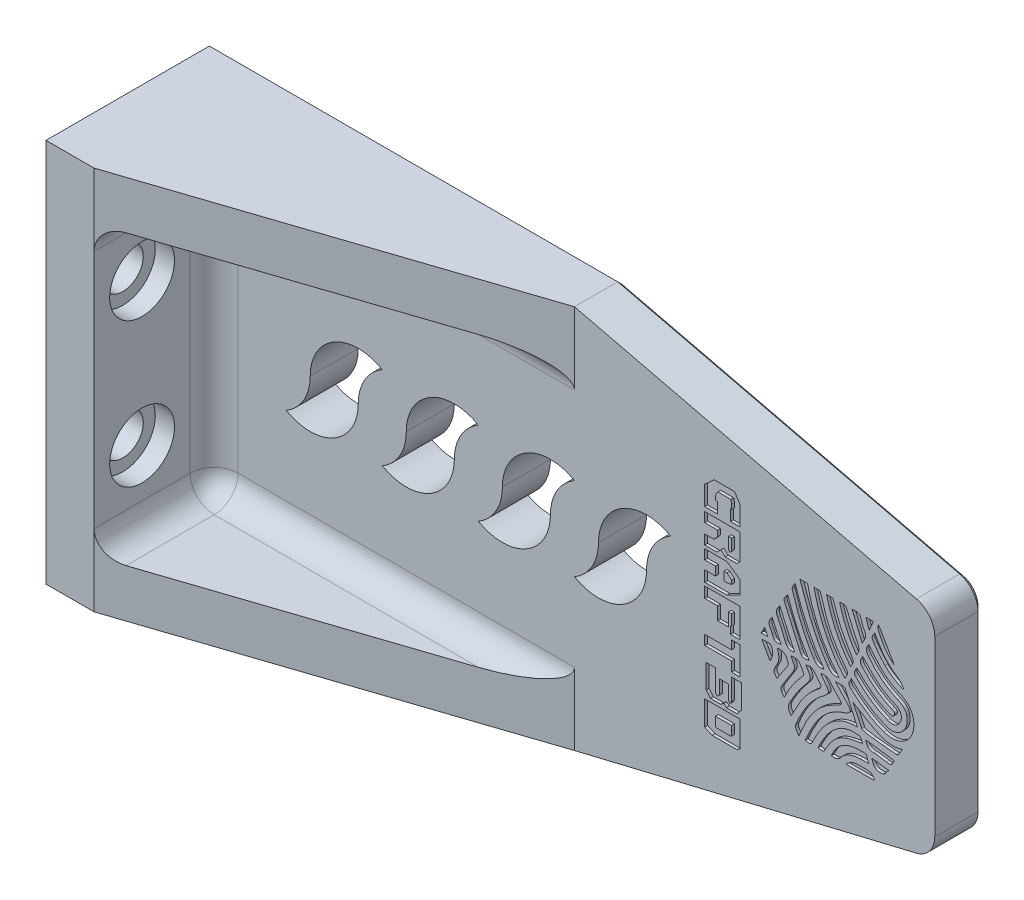
from build123d import *

# Parameters (mm, degrees)
SKETCH1_W           = 160
SKETCH1_H           = 80
BOSS_EXTRUDE1_DEPTH = 10
SKETCH2_R           = 1.325
SKETCH2_R_2         = 12.5
CUT_EXTRUDE1_DEPTH  = 3
CUT_EXTRUDE2_REACH  = 91.716
SKETCH4_R           = 1.325
SKETCH4_R_2         = 6.375
SKETCH7_W           = 10
SKETCH7_H           = 80
BOSS_EXTRUDE3_DEPTH = 25
BOSS_EXTRUDE4_DEPTH = 10
BOSS_EXTRUDE5_DEPTH = 10
CUT_EXTRUDE3_REACH  = 94.871
CUT_EXTRUDE4_DEPTH  = 10
FILLET1_R           = 5
SKETCH12_R          = 3.25
CUT_EXTRUDE5_DEPTH  = 4.5
CUT_EXTRUDE6_REACH  = 161.138
SKETCH13_R          = 4.25
SKETCH14_R          = 6.75
CUT_EXTRUDE7_DEPTH  = 4
FILLET2_R           = 5
CHAMFER2_SIZE       = 1
BOSS_EXTRUDE6_START = 3
SKETCH15_R          = 12.5
SKETCH15_R_2        = 1.325
BOSS_EXTRUDE6_DEPTH = 3
SKETCH16_R          = 3.25
BOSS_EXTRUDE7_DEPTH = 4.5
CUT_EXTRUDE9_DEPTH  = 0.6
SKETCH21_R          = 15
CUT_EXTRUDE10_DEPTH = 7
SKETCH22_R          = 3.925
BOSS_EXTRUDE8_DEPTH = 7
CHAMFER3_SIZE       = 1
CUT_EXTRUDE11_REACH = 98.047
SKETCH23_W          = 10
SKETCH23_H          = 2
CHAMFER4_SIZE       = 1


with BuildPart() as part:
    # Sketch1 → Boss-Extrude1 (new body)
    with BuildSketch(Plane.XY):
        Rectangle(SKETCH1_W, SKETCH1_H)
    extrude(amount=BOSS_EXTRUDE1_DEPTH)

    # Sketch2 → Cut-Extrude1 (cut)
    with BuildSketch(Plane.XY.offset(10)):
        with Locations((44, 15.5)):
            Circle(SKETCH2_R)
        with Locations((75, 15.5)):
            Circle(SKETCH2_R)
        with Locations((44, -15.5)):
            Circle(SKETCH2_R)
        with Locations((75, -15.5)):
            Circle(SKETCH2_R)
        with Locations((59.5, 0)):
            Circle(SKETCH2_R_2)
    extrude(amount=-CUT_EXTRUDE1_DEPTH, mode=Mode.SUBTRACT)

    # Sketch4 → Cut-Extrude2 (cut, up to next)
    with BuildSketch(Plane.XY.offset(7), mode=Mode.PRIVATE) as cut_extrude2_sk1:
        with Locations((75, -15.5)):
            Circle(SKETCH4_R)
    cut_extrude2_tool1 = extrude(cut_extrude2_sk1.sketch, amount=-CUT_EXTRUDE2_REACH, mode=Mode.PRIVATE) & part.part
    # Sketch4 → Cut-Extrude2 (cut, up to next)
    with BuildSketch(Plane.XY.offset(7), mode=Mode.PRIVATE) as cut_extrude2_sk2:
        with Locations((44, -15.5)):
            Circle(SKETCH4_R)
    cut_extrude2_tool2 = extrude(cut_extrude2_sk2.sketch, amount=-CUT_EXTRUDE2_REACH, mode=Mode.PRIVATE) & part.part
    # Sketch4 → Cut-Extrude2 (cut, up to next)
    with BuildSketch(Plane.XY.offset(7), mode=Mode.PRIVATE) as cut_extrude2_sk3:
        with Locations((75, 15.5)):
            Circle(SKETCH4_R)
    cut_extrude2_tool3 = extrude(cut_extrude2_sk3.sketch, amount=-CUT_EXTRUDE2_REACH, mode=Mode.PRIVATE) & part.part
    # Sketch4 → Cut-Extrude2 (cut, up to next)
    with BuildSketch(Plane.XY.offset(7), mode=Mode.PRIVATE) as cut_extrude2_sk4:
        with Locations((44, 15.5)):
            Circle(SKETCH4_R)
    cut_extrude2_tool4 = extrude(cut_extrude2_sk4.sketch, amount=-CUT_EXTRUDE2_REACH, mode=Mode.PRIVATE) & part.part
    # Sketch4 → Cut-Extrude2 (cut, up to next)
    with BuildSketch(Plane.XY.offset(7), mode=Mode.PRIVATE) as cut_extrude2_sk5:
        with Locations((59.5, 0)):
            Circle(SKETCH4_R_2)
    cut_extrude2_tool5 = extrude(cut_extrude2_sk5.sketch, amount=-CUT_EXTRUDE2_REACH, mode=Mode.PRIVATE) & part.part
    add(cut_extrude2_tool1.solids().sort_by_distance((75, -15.5, 7))[0], mode=Mode.SUBTRACT)
    add(cut_extrude2_tool2.solids().sort_by_distance((44, -15.5, 7))[0], mode=Mode.SUBTRACT)
    add(cut_extrude2_tool3.solids().sort_by_distance((75, 15.5, 7))[0], mode=Mode.SUBTRACT)
    add(cut_extrude2_tool4.solids().sort_by_distance((44, 15.5, 7))[0], mode=Mode.SUBTRACT)
    add(cut_extrude2_tool5.solids().sort_by_distance((59.5, 0, 7))[0], mode=Mode.SUBTRACT)

    # Sketch7 → Boss-Extrude3 (add)
    with BuildSketch(Plane.XY.offset(10)):
        with Locations((-75, 0)):
            Rectangle(SKETCH7_W, SKETCH7_H)
    extrude(amount=BOSS_EXTRUDE3_DEPTH)

    # Sketch8 → Boss-Extrude4 (add)
    with BuildSketch(Plane(origin=(0, 40, 0), x_dir=(1, 0, 0), z_dir=(0, 1, 0))):
        Polygon((-70, -35), (5, -10), (-70, -10), align=None)
    extrude(amount=-BOSS_EXTRUDE4_DEPTH)

    # Sketch9 → Boss-Extrude5 (add)
    with BuildSketch(Plane.XZ.offset(40)):
        Polygon((-70, 35), (-70, 10), (5, 10), align=None)
    extrude(amount=-BOSS_EXTRUDE5_DEPTH)

    # Sketch10 → Cut-Extrude3 (cut, up to next)
    with BuildSketch(Plane.XY.offset(10), mode=Mode.PRIVATE) as cut_extrude3_sk1:
        with BuildLine():
            ThreePointArc((5, -8.660254038), (15, -8.660254038), (20, 0))
            ThreePointArc((20, 0), (21.339745962, 5), (25, 8.660254038))
            ThreePointArc((25, 8.660254038), (15, 8.660254038), (10, 0))
            ThreePointArc((10, 0), (8.660254038, -5), (5, -8.660254038))
        make_face()
    cut_extrude3_tool1 = extrude(cut_extrude3_sk1.sketch, amount=-CUT_EXTRUDE3_REACH, mode=Mode.PRIVATE) & part.part
    # Sketch10 → Cut-Extrude3 (cut, up to next)
    with BuildSketch(Plane.XY.offset(10), mode=Mode.PRIVATE) as cut_extrude3_sk2:
        with BuildLine():
            ThreePointArc((0, 0), (1.339745962, 5), (5, 8.660254038))
            ThreePointArc((5, 8.660254038), (-5, 8.660254038), (-10, 0))
            ThreePointArc((-10, 0), (-11.339745962, -5), (-15, -8.660254038))
            ThreePointArc((-15, -8.660254038), (-5, -8.660254038), (0, 0))
        make_face()
    cut_extrude3_tool2 = extrude(cut_extrude3_sk2.sketch, amount=-CUT_EXTRUDE3_REACH, mode=Mode.PRIVATE) & part.part
    # Sketch10 → Cut-Extrude3 (cut, up to next)
    with BuildSketch(Plane.XY.offset(10), mode=Mode.PRIVATE) as cut_extrude3_sk3:
        with BuildLine():
            ThreePointArc((-20, 0), (-18.660254038, 5), (-15, 8.660254038))
            ThreePointArc((-15, 8.660254038), (-25, 8.660254038), (-30, 0))
            ThreePointArc((-30, 0), (-31.339745962, -5), (-35, -8.660254038))
            ThreePointArc((-35, -8.660254038), (-25, -8.660254038), (-20, 0))
        make_face()
    cut_extrude3_tool3 = extrude(cut_extrude3_sk3.sketch, amount=-CUT_EXTRUDE3_REACH, mode=Mode.PRIVATE) & part.part
    # Sketch10 → Cut-Extrude3 (cut, up to next)
    with BuildSketch(Plane.XY.offset(10), mode=Mode.PRIVATE) as cut_extrude3_sk4:
        with BuildLine():
            ThreePointArc((-40, 0), (-38.660254038, 5), (-35, 8.660254038))
            ThreePointArc((-35, 8.660254038), (-45, 8.660254038), (-50, 0))
            ThreePointArc((-50, 0), (-51.339745962, -5), (-55, -8.660254038))
            ThreePointArc((-55, -8.660254038), (-45, -8.660254038), (-40, 0))
        make_face()
    cut_extrude3_tool4 = extrude(cut_extrude3_sk4.sketch, amount=-CUT_EXTRUDE3_REACH, mode=Mode.PRIVATE) & part.part
    add(cut_extrude3_tool1.solids().sort_by_distance((15, 0, 10))[0], mode=Mode.SUBTRACT)
    add(cut_extrude3_tool2.solids().sort_by_distance((-5, 0, 10))[0], mode=Mode.SUBTRACT)
    add(cut_extrude3_tool3.solids().sort_by_distance((-25, 0, 10))[0], mode=Mode.SUBTRACT)
    add(cut_extrude3_tool4.solids().sort_by_distance((-45, 0, 10))[0], mode=Mode.SUBTRACT)

    # Sketch11 → Cut-Extrude4 (cut)
    with BuildSketch(Plane.XY.offset(10)):
        Polygon((80, 22), (5, 40), (80, 40), align=None)
        Polygon((80, -40), (80, -22), (5, -40), align=None)
    extrude(amount=-CUT_EXTRUDE4_DEPTH, mode=Mode.SUBTRACT)

    # Fillet1
    fillet1_edges = [part.edges().sort_by_distance(p)[0] for p in [
        (-70, 30, 22.5),
        (-32.5, 30, 10),
        (-70, 0, 10),
        (-32.5, -30, 10),
        (-70, -30, 22.5),
    ]]
    fillet(fillet1_edges, radius=FILLET1_R)

    # Sketch12 → Cut-Extrude5 (cut)
    with BuildSketch(Plane(origin=(0, 0, 0), x_dir=(-1, 0, 0), z_dir=(0, 0, -1))):
        with Locations((-75, 15.5)):
            Circle(SKETCH12_R)
        with Locations((-44, 15.5)):
            Circle(SKETCH12_R)
        with Locations((-44, -15.5)):
            Circle(SKETCH12_R)
        with Locations((-75, -15.5)):
            Circle(SKETCH12_R)
    extrude(amount=-CUT_EXTRUDE5_DEPTH, mode=Mode.SUBTRACT)

    # Sketch13 → Cut-Extrude6 (cut, up to next)
    with BuildSketch(Plane(origin=(-70, 0, 0), x_dir=(0, 0, -1), z_dir=(1, 0, 0)), mode=Mode.PRIVATE) as cut_extrude6_sk1:
        with Locations(Location((-25, 15, 0), (0, 0, 90))):
            Circle(SKETCH13_R)
    cut_extrude6_tool1 = extrude(cut_extrude6_sk1.sketch, amount=-CUT_EXTRUDE6_REACH, mode=Mode.PRIVATE) & part.part
    # Sketch13 → Cut-Extrude6 (cut, up to next)
    with BuildSketch(Plane(origin=(-70, 0, 0), x_dir=(0, 0, -1), z_dir=(1, 0, 0)), mode=Mode.PRIVATE) as cut_extrude6_sk2:
        with Locations((-25, -15)):
            Circle(SKETCH13_R)
    cut_extrude6_tool2 = extrude(cut_extrude6_sk2.sketch, amount=-CUT_EXTRUDE6_REACH, mode=Mode.PRIVATE) & part.part
    add(cut_extrude6_tool1.solids().sort_by_distance((-70, 15, 25))[0], mode=Mode.SUBTRACT)
    add(cut_extrude6_tool2.solids().sort_by_distance((-70, -15, 25))[0], mode=Mode.SUBTRACT)

    # Sketch14 → Cut-Extrude7 (cut)
    with BuildSketch(Plane(origin=(-70, 0, 0), x_dir=(0, 0, -1), z_dir=(1, 0, 0))):
        with Locations(Location((-25, 15, 0), (0, 0, 90))):
            Circle(SKETCH14_R)
        with Locations(Location((-25, -15, 0), (0, 0, 90))):
            Circle(SKETCH14_R)
    extrude(amount=-CUT_EXTRUDE7_DEPTH, mode=Mode.SUBTRACT)

    # Fillet2
    fillet2_edges = [part.edges().sort_by_distance(p)[0] for p in [
        (80, 22, 5),
        (80, -22, 5),
    ]]
    fillet(fillet2_edges, radius=FILLET2_R)

    # Chamfer2
    chamfer2_edges = [part.edges().sort_by_distance(p)[0] for p in [
        (-37.5, 40, 0),
        (40.583432381, 31.459976229, 0),
        (40.583432381, -31.459976229, 0),
        (80, 0, 0),
        (78.926469394, 21.153631895, 0),
        (78.926469394, -21.153631895, 0),
        (53.125, 0, 0),
        (-37.5, -40, 0),
        (-80, 0, 0),
    ]]
    chamfer(chamfer2_edges, length=CHAMFER2_SIZE)

    # Sketch15 → Boss-Extrude6 (add)
    with BuildSketch(Plane.XY.offset(7).offset(BOSS_EXTRUDE6_START)):
        with Locations((59.5, 0)):
            Circle(SKETCH15_R)
        with Locations((75, -15.5)):
            Circle(SKETCH15_R_2)
        with Locations((44, -15.5)):
            Circle(SKETCH15_R_2)
        with Locations((75, 15.5)):
            Circle(SKETCH15_R_2)
        with Locations((44, 15.5)):
            Circle(SKETCH15_R_2)
    extrude(amount=-BOSS_EXTRUDE6_DEPTH)

    # Sketch16 → Boss-Extrude7 (add)
    with BuildSketch(Plane(origin=(0, 0, 0), x_dir=(-1, 0, 0), z_dir=(0, 0, -1))):
        with Locations((-75, 15.5)):
            Circle(SKETCH16_R)
        with Locations((-75, -15.5)):
            Circle(SKETCH16_R)
        with Locations((-44, -15.5)):
            Circle(SKETCH16_R)
        with Locations((-44, 15.5)):
            Circle(SKETCH16_R)
    extrude(amount=-BOSS_EXTRUDE7_DEPTH)

    # Sketch20 → Cut-Extrude9 (cut)
    # profile 1 of 34: a face of its own
    with BuildSketch(Plane.XY.offset(10)):
        Polygon((39.488670308, 16.636599959), (32.112510308, 16.636599959), (32.112510308, 14.624919959), (34.794750308, 14.624919959), (34.794750308, 13.444891521), (34.053467183, 12.613239959), (32.112510308, 12.613239959), (32.112510308, 10.601559959), (34.63453187, 10.601559959), (35.506347183, 11.472938709), (36.378162495, 10.601559959), (38.896691558, 10.601559959), (39.488670308, 11.313811677), align=None)
        Polygon((37.700510308, 14.624919959), (37.700510308, 12.282543865), (37.365230308, 11.894876365), (37.029950308, 12.282543865), (37.029950308, 14.624919959), align=None, mode=Mode.SUBTRACT)
    # profile 2 of 34: a face of its own
    with BuildSketch(Plane.XY.offset(10)):
        Polygon((38.31562687, 23.342199959), (34.053467183, 23.342199959), (32.112510308, 21.563207771), (32.112510308, 17.530679959), (34.794750308, 17.530679959), (34.794750308, 19.765879959), (34.347710308, 19.765879959), (34.347710308, 20.788309334), (34.828147339, 21.554039959), (37.540510151, 21.554039959), (37.700510308, 20.788309334), (37.700510308, 19.765879959), (37.476990308, 19.765879959), (37.476990308, 17.530679959), (39.488670308, 17.530679959), (39.488670308, 21.563207771), align=None)
    # profile 3 of 34: a face of its own
    with BuildSketch(Plane.XY.offset(10)):
        Polygon((39.488670308, 8.027587459), (36.765829995, 9.930999959), (32.112510308, 9.930999959), (32.112510308, 7.919319959), (34.347710308, 7.919319959), (34.347710308, 6.131159959), (32.112510308, 6.131159959), (32.112510308, 3.895959959), (36.765829995, 3.895959959), (39.488670308, 5.315224646), align=None)
        Polygon((36.135870308, 7.919319959), (36.765829995, 7.919319959), (37.700510308, 7.058855271), (37.700510308, 6.283956834), (36.765829995, 6.131159959), (36.135870308, 6.131159959), align=None, mode=Mode.SUBTRACT)
    # profile 4 of 34: a face of its own
    with BuildSketch(Plane.XY.offset(10)):
        Polygon((32.112510308, 3.225399959), (32.112510308, 0.990199959), (34.794750308, 0.990199959), (34.794750308, -1.692040041), (37.029950308, -1.692040041), (37.029950308, 0.990199959), (37.700510308, 0.990199959), (37.700510308, -1.245000041), (37.476990308, -1.245000041), (37.476990308, -2.809640041), (39.488670308, -2.809640041), (39.488670308, 3.225399959), align=None)
    # profile 5 of 34: a face of its own
    with BuildSketch(Plane.XY.offset(10)):
        Polygon((37.700510308, -3.703720041), (37.700510308, -5.491880041), (32.112510308, -5.491880041), (32.112510308, -7.503560041), (37.700510308, -7.503560041), (37.700510308, -9.515240041), (39.488670308, -9.515240041), (39.488670308, -3.703720041), align=None)
    # profile 6 of 34: a face of its own
    with BuildSketch(Plane.XY.offset(10)):
        Polygon((39.488670308, -22.422428635), (39.488670308, -17.114920041), (32.112510308, -17.114920041), (32.112510308, -22.228594885), (33.665799683, -22.926440041), (38.896691558, -22.926440041), align=None)
        Polygon((37.540510151, -21.138280041), (34.828147339, -21.138280041), (34.347710308, -21.066028948), (34.347710308, -19.126600041), (37.700510308, -19.126600041), (37.700510308, -21.066028948), align=None, mode=Mode.SUBTRACT)
    # profile 7 of 34: a face of its own
    with BuildSketch(Plane.XY.offset(10)):
        Polygon((39.775928433, -10.409320041), (37.700510308, -10.409320041), (37.700510308, -14.879938323), (37.387713276, -15.33701926), (37.029950308, -14.879938323), (37.029950308, -11.973960041), (35.241790308, -11.973960041), (35.241790308, -14.879938323), (34.772703901, -15.33701926), (34.347710308, -14.879938323), (34.347710308, -10.409320041), (32.375757495, -10.409320041), (32.409372808, -15.377401291), (33.312184058, -16.444360041), (35.440862808, -16.444360041), (36.076061245, -15.965450979), (36.64446562, -16.444360041), (38.839938433, -16.444360041), (39.742531401, -15.377401291), align=None)
    # profile 8 of 34: a face of its own
    with BuildSketch(Plane.XY.offset(10)):
        with BuildLine():
            add(Edge.make_bspline(
                [(52.13184773, -13.026293948), (51.999678433, -13.336035041), (51.86641773, -13.645121291), (51.695176089, -14.044357698)],
                knots=[11, 11, 11, 11, 12, 12, 12, 12], degree=3))
            add(Edge.make_bspline(
                [(51.695176089, -14.044357698), (51.455612417, -13.627222229), (51.243224761, -13.310496135), (51.089773042, -12.966921448)],
                knots=[0, 0, 0, 0, 1, 1, 1, 1], degree=3))
            add(Edge.make_bspline(
                [(51.089773042, -12.966921448), (51.013047183, -12.79447926), (50.969281792, -12.54301926), (51.03705812, -12.380399729)],
                knots=[1, 1, 1, 1, 2, 2, 2, 2], degree=3))
            add(Edge.make_bspline(
                [(51.03705812, -12.380399729), (52.241315776, -9.493411916), (53.69823398, -6.771008166), (56.174634761, -4.738591448)],
                knots=[2, 2, 2, 2, 3, 3, 3, 3], degree=3))
            add(Edge.make_bspline(
                [(56.174634761, -4.738591448), (56.566013042, -4.417499729), (56.993189448, -4.137663166), (57.365249839, -3.796489573)],
                knots=[3, 3, 3, 3, 4, 4, 4, 4], degree=3))
            add(Edge.make_bspline(
                [(57.365249839, -3.796489573), (57.958756558, -3.252314416), (57.99575523, -2.91245051), (57.547732964, -2.251276604)],
                knots=[4, 4, 4, 4, 5, 5, 5, 5], degree=3))
            add(Edge.make_bspline(
                [(57.547732964, -2.251276604), (57.147623433, -1.660607541), (56.712479761, -1.094385979), (56.249941792, -0.458532698)],
                knots=[5, 5, 5, 5, 6, 6, 6, 6], degree=3))
            add(Edge.make_bspline(
                [(56.249941792, -0.458532698), (57.060529214, -0.340879104), (57.707078276, -0.248327854), (58.257037886, -1.011002541)],
                knots=[6, 6, 6, 6, 7, 7, 7, 7], degree=3))
            add(Edge.make_bspline(
                [(58.257037886, -1.011002541), (58.857857026, -1.844618635), (59.612673589, -2.570840354), (60.33060062, -3.314742854)],
                knots=[7, 7, 7, 7, 8, 8, 8, 8], degree=3))
            add(Edge.make_bspline(
                [(60.33060062, -3.314742854), (60.703534136, -3.700664104), (60.659550464, -3.901046291), (60.19253773, -4.160146135)],
                knots=[8, 8, 8, 8, 9, 9, 9, 9], degree=3))
            add(Edge.make_bspline(
                [(60.19253773, -4.160146135), (59.034228276, -4.802329573), (57.810871011, -5.37640926), (56.778291558, -6.187324104)],
                knots=[9, 9, 9, 9, 10, 10, 10, 10], degree=3))
            add(Edge.make_bspline(
                [(56.778291558, -6.187324104), (54.522900542, -7.958239885), (53.235914292, -10.442935354), (52.13184773, -13.026293948)],
                knots=[10, 10, 10, 10, 11, 11, 11, 11], degree=3))
        make_face()
    # profile 9 of 34: a face of its own
    with BuildSketch(Plane.XY.offset(10)):
        with BuildLine():
            add(Edge.make_bspline(
                [(61.365581167, -0.663717073), (62.196796167, -2.507102229), (63.014914292, -4.356162698), (63.879635464, -6.302576604)],
                knots=[10, 10, 10, 10, 11, 11, 11, 11], degree=3))
            add(Edge.make_bspline(
                [(63.879635464, -6.302576604), (59.94457023, -6.251935354), (57.543258198, -8.430382229), (55.701619292, -11.460125979)],
                knots=[0, 0, 0, 0, 1, 1, 1, 1], degree=3))
            add(Edge.make_bspline(
                [(55.701619292, -11.460125979), (55.329558901, -12.072186604), (55.012287105, -12.719172229), (54.699271792, -13.364411604)],
                knots=[1, 1, 1, 1, 2, 2, 2, 2], degree=3))
            add(Edge.make_bspline(
                [(54.699271792, -13.364411604), (54.218943901, -14.354971916), (54.229967105, -14.360428948), (53.02767398, -14.143239104)],
                knots=[2, 2, 2, 2, 3, 3, 3, 3], degree=3))
            add(Edge.make_bspline(
                [(53.02767398, -14.143239104), (54.615451792, -10.542253323), (56.309096011, -7.057829729), (60.256275855, -5.431416135)],
                knots=[3, 3, 3, 3, 4, 4, 4, 4], degree=3))
            add(Edge.make_bspline(
                [(60.256275855, -5.431416135), (60.723943433, -5.238673791), (61.216167651, -5.102466291), (61.675322261, -4.892916291)],
                knots=[4, 4, 4, 4, 5, 5, 5, 5], degree=3))
            add(Edge.make_bspline(
                [(61.675322261, -4.892916291), (62.42249898, -4.551742698), (62.579988901, -4.077854104), (62.06288062, -3.441782541)],
                knots=[5, 5, 5, 5, 6, 6, 6, 6], degree=3))
            add(Edge.make_bspline(
                [(62.06288062, -3.441782541), (61.344953589, -2.558180041), (60.53840437, -1.746828635), (59.770818355, -0.903826448)],
                knots=[6, 6, 6, 6, 7, 7, 7, 7], degree=3))
            add(Edge.make_bspline(
                [(59.770818355, -0.903826448), (59.659276636, -0.780497541), (59.554065073, -0.651275041), (59.333164448, -0.393048323)],
                knots=[7, 7, 7, 7, 8, 8, 8, 8], degree=3))
            add(Edge.make_bspline(
                [(59.333164448, -0.393048323), (59.993137808, -0.393048323), (60.524106948, -0.378205198), (61.052456714, -0.405490354)],
                knots=[8, 8, 8, 8, 9, 9, 9, 9], degree=3))
            add(Edge.make_bspline(
                [(61.052456714, -0.405490354), (61.16356187, -0.410947385), (61.314285073, -0.54977426), (61.365581167, -0.663717073)],
                knots=[9, 9, 9, 9, 10, 10, 10, 10], degree=3))
        make_face()
    # profile 10 of 34: a face of its own
    with BuildSketch(Plane.XY.offset(10)):
        with BuildLine():
            add(Edge.make_bspline(
                [(52.028273276, -7.684078635), (51.362078901, -8.807353948), (50.766061948, -9.972102698), (50.113728433, -11.164354885)],
                knots=[8, 8, 8, 8, 9, 9, 9, 9], degree=3))
            add(Edge.make_bspline(
                [(50.113728433, -11.164354885), (49.555801558, -10.48244426), (49.282949995, -9.866672854), (49.800058276, -8.931555979)],
                knots=[0, 0, 0, 0, 1, 1, 1, 1], degree=3))
            add(Edge.make_bspline(
                [(49.800058276, -8.931555979), (50.786143823, -7.147761604), (51.853320855, -5.441893635), (53.203062964, -3.911523791)],
                knots=[1, 1, 1, 1, 2, 2, 2, 2], degree=3))
            add(Edge.make_bspline(
                [(53.203062964, -3.911523791), (54.324482886, -2.640253791), (54.333432417, -2.267865979), (53.388492886, -0.873267073)],
                knots=[2, 2, 2, 2, 3, 3, 3, 3], degree=3))
            add(Edge.make_bspline(
                [(53.388492886, -0.873267073), (53.306855698, -0.752994104), (53.23198523, -0.628137229), (53.150129761, -0.499351291)],
                knots=[3, 3, 3, 3, 4, 4, 4, 4], degree=3))
            add(Edge.make_bspline(
                [(53.150129761, -0.499351291), (54.156078901, -0.204889885), (54.499544448, -0.308136916), (55.108439995, -1.071684729)],
                knots=[4, 4, 4, 4, 5, 5, 5, 5], degree=3))
            add(Edge.make_bspline(
                [(55.108439995, -1.071684729), (55.410977808, -1.451930666), (55.703147261, -1.840907854), (56.019655073, -2.208930041)],
                knots=[5, 5, 5, 5, 6, 6, 6, 6], degree=3))
            add(Edge.make_bspline(
                [(56.019655073, -2.208930041), (56.42249312, -2.678016448), (56.368686792, -3.058917229), (55.88115562, -3.436107229)],
                knots=[6, 6, 6, 6, 7, 7, 7, 7], degree=3))
            add(Edge.make_bspline(
                [(55.88115562, -3.436107229), (54.346856714, -4.623338948), (53.020470698, -6.010734573), (52.028273276, -7.684078635)],
                knots=[7, 7, 7, 7, 8, 8, 8, 8], degree=3))
        make_face()
    # profile 11 of 34: a face of its own
    with BuildSketch(Plane.XY.offset(10)):
        with BuildLine():
            add(Edge.make_bspline(
                [(64.582937651, -7.898867385), (64.749595386, -8.211227854), (64.875543667, -8.544543323), (64.963620151, -8.745580354)],
                knots=[6, 6, 6, 6, 7, 7, 7, 7], degree=3))
            add(Edge.make_bspline(
                [(64.963620151, -8.745580354), (63.694423823, -9.023234104), (62.438433511, -9.153984573), (61.293766636, -9.581815823)],
                knots=[0, 0, 0, 0, 1, 1, 1, 1], degree=3))
            add(Edge.make_bspline(
                [(61.293766636, -9.581815823), (59.447325542, -10.272239416), (58.267297105, -11.758298166), (57.352807808, -13.454343479)],
                knots=[1, 1, 1, 1, 2, 2, 2, 2], degree=3))
            add(Edge.make_bspline(
                [(57.352807808, -13.454343479), (56.874553589, -14.341438479), (56.869314839, -14.352570823), (55.69779937, -14.13734551)],
                knots=[2, 2, 2, 2, 3, 3, 3, 3], degree=3))
            add(Edge.make_bspline(
                [(55.69779937, -14.13734551), (56.816599917, -11.841681604), (58.043449683, -9.671965979), (60.319249995, -8.33281051)],
                knots=[3, 3, 3, 3, 4, 4, 4, 4], degree=3))
            add(Edge.make_bspline(
                [(60.319249995, -8.33281051), (61.539660464, -7.614665198), (62.890821401, -7.565551916), (64.256388901, -7.676002229)],
                knots=[4, 4, 4, 4, 5, 5, 5, 5], degree=3))
            add(Edge.make_bspline(
                [(64.256388901, -7.676002229), (64.37306023, -7.685606604), (64.527057651, -7.793655823), (64.582937651, -7.898867385)],
                knots=[5, 5, 5, 5, 6, 6, 6, 6], degree=3))
        make_face()
    # profile 12 of 34: a face of its own
    with BuildSketch(Plane.XY.offset(10)):
        with BuildLine():
            add(Edge.make_bspline(
                [(50.510782026, -1.265518479), (50.357985151, -1.022789729), (50.261068276, -0.744699416), (50.085788433, -0.369692229)],
                knots=[7, 7, 7, 7, 8, 8, 8, 8], degree=3))
            add(Edge.make_bspline(
                [(50.085788433, -0.369692229), (50.639349683, -0.39959676), (51.278695464, -0.243089104), (51.547290542, -0.489528635)],
                knots=[0, 0, 0, 0, 1, 1, 1, 1], degree=3))
            add(Edge.make_bspline(
                [(51.547290542, -0.489528635), (52.056213276, -0.956213948), (52.378723823, -1.640525666), (52.71509523, -2.268520823)],
                knots=[1, 1, 1, 1, 2, 2, 2, 2], degree=3))
            add(Edge.make_bspline(
                [(52.71509523, -2.268520823), (52.784290386, -2.397961604), (52.628874136, -2.727566291), (52.486118198, -2.879053479)],
                knots=[2, 2, 2, 2, 3, 3, 3, 3], degree=3))
            add(Edge.make_bspline(
                [(52.486118198, -2.879053479), (50.910345855, -4.556544885), (49.627179526, -6.426996916), (48.703194995, -8.55109176)],
                knots=[3, 3, 3, 3, 4, 4, 4, 4], degree=3))
            add(Edge.make_bspline(
                [(48.703194995, -8.55109176), (47.856482026, -7.709180979), (47.78728687, -7.341595354), (48.367696714, -6.391635354)],
                knots=[4, 4, 4, 4, 5, 5, 5, 5], degree=3))
            add(Edge.make_bspline(
                [(48.367696714, -6.391635354), (49.038911558, -5.293244104), (49.73086312, -4.20642176), (50.438530933, -3.130950041)],
                knots=[5, 5, 5, 5, 6, 6, 6, 6], degree=3))
            add(Edge.make_bspline(
                [(50.438530933, -3.130950041), (50.847371714, -2.509939885), (50.918094839, -1.912067541), (50.510782026, -1.265518479)],
                knots=[6, 6, 6, 6, 7, 7, 7, 7], degree=3))
        make_face()
    # profile 13 of 34: a face of its own
    with BuildSketch(Plane.XY.offset(10)):
        with BuildLine():
            add(Edge.make_bspline(
                [(60.476521636, -13.507822385), (59.924597495, -14.21243426), (59.33174562, -14.32943301), (58.510789839, -14.173143635)],
                knots=[4, 4, 4, 4, 5, 5, 5, 5], degree=3))
            add(Edge.make_bspline(
                [(58.510789839, -14.173143635), (59.438921714, -11.637588635), (61.374967261, -10.302798791), (64.29971773, -10.25892426)],
                knots=[0, 0, 0, 0, 1, 1, 1, 1], degree=3))
            add(Edge.make_bspline(
                [(64.29971773, -10.25892426), (65.905394605, -10.234040198), (65.583648042, -10.012048166), (66.270469995, -11.749130354)],
                knots=[1, 1, 1, 1, 2, 2, 2, 2], degree=3))
            add(Edge.make_bspline(
                [(66.270469995, -11.749130354), (65.653498042, -11.749130354), (65.056280542, -11.738216291), (64.459172183, -11.750876604)],
                knots=[2, 2, 2, 2, 3, 3, 3, 3], degree=3))
            add(Edge.make_bspline(
                [(64.459172183, -11.750876604), (62.88874773, -11.784273635), (61.461297495, -12.251832073), (60.476521636, -13.507822385)],
                knots=[3, 3, 3, 3, 4, 4, 4, 4], degree=3))
        make_face()
    # profile 14 of 34: a face of its own
    with BuildSketch(Plane.XY.offset(10)):
        with BuildLine():
            add(Edge.make_bspline(
                [(47.22324812, -0.414221604), (47.361856714, -0.401779573), (47.445240151, -0.389337541), (47.529714995, -0.38737301)],
                knots=[0, 0, 0, 0, 1, 1, 1, 1], degree=3))
            add(Edge.make_bspline(
                [(47.529714995, -0.38737301), (48.566332651, -0.359651291), (49.206551558, -0.823280666), (49.428980151, -1.840689573)],
                knots=[1, 1, 1, 1, 2, 2, 2, 2], degree=3))
            add(Edge.make_bspline(
                [(49.428980151, -1.840689573), (49.486169839, -2.101972229), (49.435528589, -2.456024416), (49.294518901, -2.679544416)],
                knots=[2, 2, 2, 2, 3, 3, 3, 3], degree=3))
            add(Edge.make_bspline(
                [(49.294518901, -2.679544416), (48.608897495, -3.765275354), (47.875690776, -4.821538323), (47.160164839, -5.887405666)],
                knots=[3, 3, 3, 3, 4, 4, 4, 4], degree=3))
            add(Edge.make_bspline(
                [(47.160164839, -5.887405666), (46.387230933, -4.991579416), (46.375880308, -4.90841426), (46.887749839, -3.884238635)],
                knots=[4, 4, 4, 4, 5, 5, 5, 5], degree=3))
            add(Edge.make_bspline(
                [(46.887749839, -3.884238635), (46.916344683, -3.827703791), (46.93860937, -3.76811301), (46.966767651, -3.711141604)],
                knots=[5, 5, 5, 5, 6, 6, 6, 6], degree=3))
            add(Edge.make_bspline(
                [(47.22324812, -0.414221604), (47.458348419, -1.055787397), (47.934564138, -2.329314525), (46.966767651, -3.711141604)],
                knots=[0, 0, 0, 0, 1, 1, 1, 1], degree=3))
        make_face()
    # profile 15 of 34: a face of its own
    with BuildSketch(Plane.XY.offset(10)):
        with BuildLine():
            add(Edge.make_bspline(
                [(67.335027651, -14.183839416), (65.433470542, -14.183839416), (63.53147687, -14.183839416), (61.49873273, -14.183839416)],
                knots=[4, 4, 4, 4, 5, 5, 5, 5], degree=3))
            add(Edge.make_bspline(
                [(61.49873273, -14.183839416), (62.179115386, -13.494943791), (62.920725933, -13.125175354), (63.747575308, -13.060564104)],
                knots=[0, 0, 0, 0, 1, 1, 1, 1], degree=3))
            add(Edge.make_bspline(
                [(63.747575308, -13.060564104), (64.68749437, -12.987003323), (65.650223823, -12.973469885), (66.577809995, -13.106839729)],
                knots=[1, 1, 1, 1, 2, 2, 2, 2], degree=3))
            add(Edge.make_bspline(
                [(66.577809995, -13.106839729), (66.913199136, -13.155079885), (67.176228042, -13.703402385), (67.472108276, -14.02383926)],
                knots=[2, 2, 2, 2, 3, 3, 3, 3], degree=3))
            add(Edge.make_bspline(
                [(67.472108276, -14.02383926), (67.426378355, -14.077318166), (67.380648433, -14.130578791), (67.335027651, -14.183839416)],
                knots=[3, 3, 3, 3, 4, 4, 4, 4], degree=3))
        make_face()
    # profile 16 of 34: a face of its own
    with BuildSketch(Plane.XY.offset(10)):
        with BuildLine():
            add(Edge.make_bspline(
                [(45.822100776, -3.381755198), (45.76163687, -3.373678791), (45.701391245, -3.366038948), (45.641582183, -3.357962541)],
                knots=[4, 4, 4, 4, 5, 5, 5, 5], degree=3))
            add(Edge.make_bspline(
                [(45.641582183, -3.357962541), (45.104173745, -2.411713323), (44.566983589, -1.46480926), (43.960816558, -0.396540823)],
                knots=[0, 0, 0, 0, 1, 1, 1, 1], degree=3))
            add(Edge.make_bspline(
                [(43.960816558, -0.396540823), (44.58466437, -0.396540823), (45.119453433, -0.360960979), (45.64638437, -0.409419416)],
                knots=[1, 1, 1, 1, 2, 2, 2, 2], degree=3))
            add(Edge.make_bspline(
                [(45.64638437, -0.409419416), (45.974242808, -0.439978791), (46.371732964, -1.457387698), (46.259754683, -2.020989885)],
                knots=[2, 2, 2, 2, 3, 3, 3, 3], degree=3))
            add(Edge.make_bspline(
                [(46.259754683, -2.020989885), (46.167203433, -2.484837541), (45.971841714, -2.929039885), (45.822100776, -3.381755198)],
                knots=[3, 3, 3, 3, 4, 4, 4, 4], degree=3))
        make_face()
    # profile 17 of 34: a face of its own
    with BuildSketch(Plane.XY.offset(10)):
        with BuildLine():
            add(Edge.make_bspline(
                [(65.99543562, 9.285760584), (66.101192886, 9.439867146), (66.164276167, 9.623441677), (66.234890151, 9.768162146)],
                knots=[15, 15, 15, 15, 16, 16, 16, 16], degree=3))
            add(Edge.make_bspline(
                [(66.234890151, 9.768162146), (67.102230698, 8.735473552), (67.900266948, 7.666986834), (68.821195542, 6.718336521)],
                knots=[0, 0, 0, 0, 1, 1, 1, 1], degree=3))
            add(Edge.make_bspline(
                [(68.821195542, 6.718336521), (69.964443589, 5.540927459), (71.366573198, 4.70993074), (72.878607417, 4.061417146)],
                knots=[1, 1, 1, 1, 2, 2, 2, 2], degree=3))
            add(Edge.make_bspline(
                [(72.878607417, 4.061417146), (74.87686312, 3.204444959), (75.869169683, 1.471510115), (75.618146245, -0.653894416)],
                knots=[2, 2, 2, 2, 3, 3, 3, 3], degree=3))
            add(Edge.make_bspline(
                [(75.618146245, -0.653894416), (75.37454437, -2.718398479), (73.861091323, -4.396326448), (71.808374448, -4.666776916)],
                knots=[3, 3, 3, 3, 4, 4, 4, 4], degree=3))
            add(Edge.make_bspline(
                [(71.808374448, -4.666776916), (71.026054448, -4.769805666), (70.147581558, -4.662629573), (69.397458042, -4.405057698)],
                knots=[4, 4, 4, 4, 5, 5, 5, 5], degree=3))
            add(Edge.make_bspline(
                [(69.397458042, -4.405057698), (66.801984839, -3.515561604), (64.590795776, -1.97646051), (62.573113042, -0.131547385)],
                knots=[5, 5, 5, 5, 6, 6, 6, 6], degree=3))
            add(Edge.make_bspline(
                [(62.573113042, -0.131547385), (62.080779683, 0.31811199), (61.952321167, 0.707307459), (62.33693273, 1.253447146)],
                knots=[6, 6, 6, 6, 7, 7, 7, 7], degree=3))
            add(Edge.make_bspline(
                [(62.33693273, 1.253447146), (62.432758198, 1.389436365), (62.494750073, 1.548999959), (62.606291792, 1.763352146)],
                knots=[7, 7, 7, 7, 8, 8, 8, 8], degree=3))
            add(Edge.make_bspline(
                [(62.606291792, 1.763352146), (63.039798355, 1.353419959), (63.44056273, 0.964442771), (63.851804605, 0.586816209)],
                knots=[8, 8, 8, 8, 9, 9, 9, 9], degree=3))
            add(Edge.make_bspline(
                [(63.851804605, 0.586816209), (65.55003273, -0.974331291), (67.481057808, -2.164618948), (69.609954839, -3.044510666)],
                knots=[9, 9, 9, 9, 10, 10, 10, 10], degree=3))
            add(Edge.make_bspline(
                [(69.609954839, -3.044510666), (70.820870073, -3.545684416), (71.97099398, -3.522983166), (72.995387886, -2.643964573)],
                knots=[10, 10, 10, 10, 11, 11, 11, 11], degree=3))
            add(Edge.make_bspline(
                [(72.995387886, -2.643964573), (74.046412105, -1.742899573), (74.414870855, -0.534712854), (74.197353589, 0.787198396)],
                knots=[11, 11, 11, 11, 12, 12, 12, 12], degree=3))
            add(Edge.make_bspline(
                [(74.197353589, 0.787198396), (74.020982339, 1.86005074), (73.196097495, 2.458141365), (72.232058355, 2.852793865)],
                knots=[12, 12, 12, 12, 13, 13, 13, 13], degree=3))
            add(Edge.make_bspline(
                [(72.232058355, 2.852793865), (69.761005464, 3.863654334), (67.803022651, 5.512550896), (66.173334839, 7.608487459)],
                knots=[13, 13, 13, 13, 14, 14, 14, 14], degree=3))
            add(Edge.make_bspline(
                [(66.173334839, 7.608487459), (65.722693198, 8.187369334), (65.571206011, 8.669116052), (65.99543562, 9.285760584)],
                knots=[14, 14, 14, 14, 15, 15, 15, 15], degree=3))
        make_face()
    # profile 18 of 34: a face of its own
    with BuildSketch(Plane.XY.offset(10)):
        with BuildLine():
            add(Edge.make_bspline(
                [(64.74861312, 6.534543709), (64.845311714, 6.669004959), (64.901191714, 6.832715896), (64.979991245, 6.990969802)],
                knots=[13, 13, 13, 13, 14, 14, 14, 14], degree=3))
            add(Edge.make_bspline(
                [(64.979991245, 6.990969802), (65.821028901, 6.112606052), (66.60138437, 5.221145427), (67.462831323, 4.417215584)],
                knots=[0, 0, 0, 0, 1, 1, 1, 1], degree=3))
            add(Edge.make_bspline(
                [(67.462831323, 4.417215584), (68.708780698, 3.253339959), (70.166244605, 2.397022615), (71.727937808, 1.716421677)],
                knots=[1, 1, 1, 1, 2, 2, 2, 2], degree=3))
            add(Edge.make_bspline(
                [(71.727937808, 1.716421677), (72.945838042, 1.185779959), (73.33830773, 0.277729959), (72.863218589, -0.886145666)],
                knots=[2, 2, 2, 2, 3, 3, 3, 3], degree=3))
            add(Edge.make_bspline(
                [(72.863218589, -0.886145666), (72.412249526, -1.989557385), (71.382289448, -2.41476926), (70.196694839, -1.944591448)],
                knots=[3, 3, 3, 3, 4, 4, 4, 4], degree=3))
            add(Edge.make_bspline(
                [(70.196694839, -1.944591448), (67.620976089, -0.921943791), (65.412297261, 0.642259646), (63.49993523, 2.640406209)],
                knots=[4, 4, 4, 4, 5, 5, 5, 5], degree=3))
            add(Edge.make_bspline(
                [(63.49993523, 2.640406209), (63.227301948, 2.924826677), (63.160617026, 3.175850115), (63.379662261, 3.520297927)],
                knots=[5, 5, 5, 5, 6, 6, 6, 6], degree=3))
            add(Edge.make_bspline(
                [(63.379662261, 3.520297927), (63.534423667, 3.76346324), (63.631777105, 4.043299802), (63.749212417, 4.294541521)],
                knots=[6, 6, 6, 6, 7, 7, 7, 7], degree=3))
            add(Edge.make_bspline(
                [(63.749212417, 4.294541521), (64.340318042, 3.729411365), (64.90752187, 3.170393084), (65.492297339, 2.630365271)],
                knots=[7, 7, 7, 7, 8, 8, 8, 8], degree=3))
            add(Edge.make_bspline(
                [(65.492297339, 2.630365271), (66.997564839, 1.24013199), (68.701359136, 0.165096834), (70.593748433, -0.629010354)],
                knots=[8, 8, 8, 8, 9, 9, 9, 9], degree=3))
            add(Edge.make_bspline(
                [(70.593748433, -0.629010354), (71.100270073, -0.841179729), (71.397241714, -0.734440198), (71.590857183, -0.269719416)],
                knots=[9, 9, 9, 9, 10, 10, 10, 10], degree=3))
            add(Edge.make_bspline(
                [(71.590857183, -0.269719416), (71.793422183, 0.216392927), (71.405099839, 0.376829646), (71.078223667, 0.509981209)],
                knots=[10, 10, 10, 10, 11, 11, 11, 11], degree=3))
            add(Edge.make_bspline(
                [(71.078223667, 0.509981209), (68.679858433, 1.489627459), (66.705067964, 3.03527699), (64.97726273, 4.944364802)],
                knots=[11, 11, 11, 11, 12, 12, 12, 12], degree=3))
            add(Edge.make_bspline(
                [(64.97726273, 4.944364802), (64.503483276, 5.468021521), (64.310413511, 5.924447615), (64.74861312, 6.534543709)],
                knots=[12, 12, 12, 12, 13, 13, 13, 13], degree=3))
        make_face()
    # profile 19 of 34: a face of its own
    with BuildSketch(Plane.XY.offset(10)):
        with BuildLine():
            add(Edge.make_bspline(
                [(64.782883276, -6.082985666), (64.16012687, -4.818482385), (63.57164062, -3.536516604), (63.012513198, -2.345574104)],
                knots=[7, 7, 7, 7, 8, 8, 8, 8], degree=3))
            add(Edge.make_bspline(
                [(63.012513198, -2.345574104), (64.52323773, -3.220881916), (66.034289683, -4.191142073), (67.629161636, -4.994635354)],
                knots=[0, 0, 0, 0, 1, 1, 1, 1], degree=3))
            add(Edge.make_bspline(
                [(67.629161636, -4.994635354), (69.364934136, -5.869288323), (71.201225151, -6.409097854), (73.274023901, -5.64882426)],
                knots=[1, 1, 1, 1, 2, 2, 2, 2], degree=3))
            add(Edge.make_bspline(
                [(73.274023901, -5.64882426), (72.97868937, -6.16396801), (72.762700073, -6.592672385), (72.492795308, -6.984050666)],
                knots=[2, 2, 2, 2, 3, 3, 3, 3], degree=3))
            add(Edge.make_bspline(
                [(72.492795308, -6.984050666), (72.408211323, -7.106288166), (72.173777261, -7.200149104), (72.018579292, -7.187052229)],
                knots=[3, 3, 3, 3, 4, 4, 4, 4], degree=3))
            add(Edge.make_bspline(
                [(72.018579292, -7.187052229), (70.424034761, -7.053245823), (68.830254214, -6.905687698), (67.239202183, -6.737611135)],
                knots=[4, 4, 4, 4, 5, 5, 5, 5], degree=3))
            add(Edge.make_bspline(
                [(67.239202183, -6.737611135), (66.588942339, -6.669070823), (65.940974448, -6.561458166), (65.301082964, -6.429179729)],
                knots=[5, 5, 5, 5, 6, 6, 6, 6], degree=3))
            add(Edge.make_bspline(
                [(65.301082964, -6.429179729), (65.108777183, -6.389889104), (64.863647339, -6.247351448), (64.782883276, -6.082985666)],
                knots=[6, 6, 6, 6, 7, 7, 7, 7], degree=3))
        make_face()
    # profile 20 of 34: a face of its own
    with BuildSketch(Plane.XY.offset(10)):
        with BuildLine():
            add(Edge.make_bspline(
                [(73.540327026, 5.37874449), (73.492305151, 5.333778552), (73.444501558, 5.289030896), (73.396807105, 5.244064959)],
                knots=[6, 6, 6, 6, 7, 7, 7, 7], degree=3))
            add(Edge.make_bspline(
                [(73.396807105, 5.244064959), (71.997515151, 5.822946834), (70.674730776, 6.557244959), (69.62403398, 7.663494334)],
                knots=[0, 0, 0, 0, 1, 1, 1, 1], degree=3))
            add(Edge.make_bspline(
                [(69.62403398, 7.663494334), (68.815192808, 8.515446052), (68.092245308, 9.460822146), (67.414045464, 10.422787615)],
                knots=[1, 1, 1, 1, 2, 2, 2, 2], degree=3))
            add(Edge.make_bspline(
                [(67.414045464, 10.422787615), (66.78823312, 11.310537459), (66.841821167, 11.450892302), (67.494700386, 12.418314802)],
                knots=[2, 2, 2, 2, 3, 3, 3, 3], degree=3))
            add(Edge.make_bspline(
                [(67.494700386, 12.418314802), (68.003404839, 11.577495427), (68.47500148, 10.711355427), (69.030199839, 9.901968552)],
                knots=[3, 3, 3, 3, 4, 4, 4, 4], degree=3))
            add(Edge.make_bspline(
                [(69.030199839, 9.901968552), (69.949273042, 8.561721677), (71.135849917, 7.507204959), (72.530557964, 6.651979021)],
                knots=[4, 4, 4, 4, 5, 5, 5, 5], degree=3))
            add(Edge.make_bspline(
                [(72.530557964, 6.651979021), (72.964282808, 6.386112459), (73.20908523, 5.811596209), (73.540327026, 5.37874449)],
                knots=[5, 5, 5, 5, 6, 6, 6, 6], degree=3))
        make_face()
    # profile 21 of 34: a face of its own
    with BuildSketch(Plane.XY.offset(10)):
        with BuildLine():
            add(Edge.make_bspline(
                [(65.655353433, -7.749999573), (67.624250308, -8.016520979), (69.568372261, -8.279986448), (71.566300542, -8.550873479)],
                knots=[3, 3, 3, 3, 4, 4, 4, 4], degree=3))
            add(Edge.make_bspline(
                [(71.566300542, -8.550873479), (70.99833273, -9.702961916), (70.996804761, -9.714312541), (69.887499448, -9.58312551)],
                knots=[0, 0, 0, 0, 1, 1, 1, 1], degree=3))
            add(Edge.make_bspline(
                [(69.887499448, -9.58312551), (69.030963823, -9.482061291), (68.179230386, -9.262688635), (67.323458745, -9.252211135)],
                knots=[1, 1, 1, 1, 2, 2, 2, 2], degree=3))
            add(Edge.make_bspline(
                [(67.323458745, -9.252211135), (66.325586011, -9.239987385), (65.827468198, -8.790109729), (65.655353433, -7.749999573)],
                knots=[2, 2, 2, 2, 3, 3, 3, 3], degree=3))
        make_face()
    # profile 22 of 34: a face of its own
    with BuildSketch(Plane.XY.offset(10)):
        with BuildLine():
            add(Edge.make_bspline(
                [(69.238440151, -12.102309416), (67.749543745, -12.280863479), (67.376282808, -11.946674885), (66.889188198, -10.418706135)],
                knots=[2, 2, 2, 2, 3, 3, 3, 3], degree=3))
            add(Edge.make_bspline(
                [(66.889188198, -10.418706135), (68.000676323, -10.566482541), (69.078658276, -10.70945676), (70.403298042, -10.885609729)],
                knots=[0, 0, 0, 0, 1, 1, 1, 1], degree=3))
            add(Edge.make_bspline(
                [(70.403298042, -10.885609729), (69.944470855, -11.387656604), (69.628399605, -12.05581551), (69.238440151, -12.102309416)],
                knots=[1, 1, 1, 1, 2, 2, 2, 2], degree=3))
        make_face()
    # profile 23 of 34: a face of its own
    with BuildSketch(Plane.XY.offset(10)):
        with BuildLine():
            add(Edge.make_bspline(
                [(68.357020464, 14.255369802), (69.426052886, 12.401507146), (70.494867026, 10.546989646), (71.563899448, 8.692908709)],
                knots=[3, 3, 3, 3, 4, 4, 4, 4], degree=3))
            add(Edge.make_bspline(
                [(71.563899448, 8.692908709), (69.911182964, 9.967452927), (68.895629448, 11.678559646), (68.158384526, 13.569966677)],
                knots=[0, 0, 0, 0, 1, 1, 1, 1], degree=3))
            add(Edge.make_bspline(
                [(68.158384526, 13.569966677), (68.084387183, 13.760307927), (68.181413198, 14.017661521), (68.198875698, 14.243800896)],
                knots=[1, 1, 1, 1, 2, 2, 2, 2], degree=3))
            add(Edge.make_bspline(
                [(68.198875698, 14.243800896), (68.251699761, 14.248166521), (68.304414683, 14.25144074), (68.357020464, 14.255369802)],
                knots=[2, 2, 2, 2, 3, 3, 3, 3], degree=3))
        make_face()
    # profile 24 of 34: a face of its own
    with BuildSketch(Plane.XY.offset(10)):
        with BuildLine():
            add(Edge.make_bspline(
                [(53.525136948, 14.378262146), (54.618071167, 9.29383699), (56.701456558, 4.687884334), (60.09300148, 0.679804021)],
                knots=[4, 4, 4, 4, 5, 5, 5, 5], degree=3))
            add(Edge.make_bspline(
                [(60.09300148, 0.679804021), (58.909698823, 0.328371209), (58.27002562, 0.807716834), (57.661130073, 1.698086052)],
                knots=[0, 0, 0, 0, 1, 1, 1, 1], degree=3))
            add(Edge.make_bspline(
                [(57.661130073, 1.698086052), (55.494252105, 4.86709324), (53.968138745, 8.325759646), (52.772284917, 11.949446677)],
                knots=[1, 1, 1, 1, 2, 2, 2, 2], degree=3))
            add(Edge.make_bspline(
                [(52.772284917, 11.949446677), (52.508601167, 12.74791949), (52.224071558, 13.539189021), (51.933866636, 14.378262146)],
                knots=[2, 2, 2, 2, 3, 3, 3, 3], degree=3))
            add(Edge.make_bspline(
                [(51.933866636, 14.378262146), (52.502380151, 14.378262146), (53.002680776, 14.378262146), (53.525136948, 14.378262146)],
                knots=[3, 3, 3, 3, 4, 4, 4, 4], degree=3))
        make_face()
    # profile 25 of 34: a face of its own
    with BuildSketch(Plane.XY.offset(10)):
        with BuildLine():
            add(Edge.make_bspline(
                [(61.624026167, 1.780596365), (61.513248433, 1.612519802), (61.444489839, 1.416939802), (61.327818511, 1.175084177)],
                knots=[5, 5, 5, 5, 6, 6, 6, 6], degree=3))
            add(Edge.make_bspline(
                [(61.327818511, 1.175084177), (57.864568198, 4.966411209), (55.978290776, 9.464751209), (54.823255542, 14.368002927)],
                knots=[0, 0, 0, 0, 1, 1, 1, 1], degree=3))
            add(Edge.make_bspline(
                [(54.823255542, 14.368002927), (55.266803042, 14.368002927), (55.699873042, 14.368002927), (56.13425273, 14.368002927)],
                knots=[1, 1, 1, 1, 2, 2, 2, 2], degree=3))
            add(Edge.make_bspline(
                [(56.13425273, 14.368002927), (56.537418198, 13.092367302), (56.903039292, 11.797522927), (57.354772339, 10.534329334)],
                knots=[2, 2, 2, 2, 3, 3, 3, 3], degree=3))
            add(Edge.make_bspline(
                [(57.354772339, 10.534329334), (58.314554995, 7.852962459), (59.664078823, 5.373724021), (61.462498042, 3.162098396)],
                knots=[3, 3, 3, 3, 4, 4, 4, 4], degree=3))
            add(Edge.make_bspline(
                [(61.462498042, 3.162098396), (61.857259683, 2.676204334), (61.962252964, 2.294212146), (61.624026167, 1.780596365)],
                knots=[4, 4, 4, 4, 5, 5, 5, 5], degree=3))
        make_face()
    # profile 26 of 34: a face of its own
    with BuildSketch(Plane.XY.offset(10)):
        with BuildLine():
            add(Edge.make_bspline(
                [(50.905543667, 13.139734334), (52.369883433, 8.705132459), (54.215669683, 4.504091521), (56.960774683, 0.618030427)],
                knots=[4, 4, 4, 4, 5, 5, 5, 5], degree=3))
            add(Edge.make_bspline(
                [(56.960774683, 0.618030427), (56.748714448, 0.600786209), (56.66522187, 0.601441052), (56.584348667, 0.586379646)],
                knots=[0, 0, 0, 0, 1, 1, 1, 1], degree=3))
            add(Edge.make_bspline(
                [(56.584348667, 0.586379646), (55.754552495, 0.432709646), (55.252178198, 0.791127459), (54.799244605, 1.496175896)],
                knots=[1, 1, 1, 1, 2, 2, 2, 2], degree=3))
            add(Edge.make_bspline(
                [(54.799244605, 1.496175896), (52.772612339, 4.652959334), (51.411410464, 8.09940199), (50.336157026, 11.663279959)],
                knots=[2, 2, 2, 2, 3, 3, 3, 3], degree=3))
            add(Edge.make_bspline(
                [(50.336157026, 11.663279959), (50.212391558, 12.071902459), (50.634110933, 12.645327302), (50.905543667, 13.139734334)],
                knots=[3, 3, 3, 3, 4, 4, 4, 4], degree=3))
        make_face()
    # profile 27 of 34: a face of its own
    with BuildSketch(Plane.XY.offset(10)):
        with BuildLine():
            add(Edge.make_bspline(
                [(62.53960687, 6.103874802), (63.178297808, 5.030585896), (63.228284214, 5.022727771), (62.464845542, 3.854923084)],
                knots=[4, 4, 4, 4, 5, 5, 5, 5], degree=3))
            add(Edge.make_bspline(
                [(62.464845542, 3.854923084), (59.99881312, 6.983329959), (58.404814292, 10.497876365), (57.47362648, 14.377389021)],
                knots=[0, 0, 0, 0, 1, 1, 1, 1], degree=3))
            add(Edge.make_bspline(
                [(57.47362648, 14.377389021), (57.956246323, 14.377389021), (58.393027105, 14.377389021), (58.796738276, 14.377389021)],
                knots=[1, 1, 1, 1, 2, 2, 2, 2], degree=3))
            add(Edge.make_bspline(
                [(58.796738276, 14.377389021), (59.289508198, 12.993049334), (59.68972687, 11.586444959), (60.287271792, 10.269772459)],
                knots=[2, 2, 2, 2, 3, 3, 3, 3], degree=3))
            add(Edge.make_bspline(
                [(60.287271792, 10.269772459), (60.938404761, 8.835664646), (61.732293667, 7.460056209), (62.53960687, 6.103874802)],
                knots=[3, 3, 3, 3, 4, 4, 4, 4], degree=3))
        make_face()
    # profile 28 of 34: a face of its own
    with BuildSketch(Plane.XY.offset(10)):
        with BuildLine():
            add(Edge.make_bspline(
                [(49.36764312, 10.330891209), (50.57080937, 6.973725584), (51.895667417, 3.707801521), (53.858779839, 0.654919959)],
                knots=[3, 3, 3, 3, 4, 4, 4, 4], degree=3))
            add(Edge.make_bspline(
                [(53.858779839, 0.654919959), (52.471056792, 0.467198084), (52.396622886, 0.432273084), (51.862597808, 1.57366574)],
                knots=[0, 0, 0, 0, 1, 1, 1, 1], degree=3))
            add(Edge.make_bspline(
                [(51.862597808, 1.57366574), (50.765079683, 3.917351521), (49.74308687, 6.297490271), (48.718474683, 8.674573084)],
                knots=[1, 1, 1, 1, 2, 2, 2, 2], degree=3))
            add(Edge.make_bspline(
                [(48.718474683, 8.674573084), (48.406114214, 9.399485115), (49.142813433, 9.767725584), (49.36764312, 10.330891209)],
                knots=[2, 2, 2, 2, 3, 3, 3, 3], degree=3))
        make_face()
    # profile 29 of 34: a face of its own
    with BuildSketch(Plane.XY.offset(10)):
        with BuildLine():
            add(Edge.make_bspline(
                [(64.030249526, 7.175854021), (63.926347651, 7.019564646), (63.860644995, 6.838391209), (63.729567105, 6.570778396)],
                knots=[5, 5, 5, 5, 6, 6, 6, 6], degree=3))
            add(Edge.make_bspline(
                [(63.729567105, 6.570778396), (62.012457651, 8.989334646), (60.922251948, 11.566581365), (60.188281245, 14.29858949)],
                knots=[0, 0, 0, 0, 1, 1, 1, 1], degree=3))
            add(Edge.make_bspline(
                [(60.188281245, 14.29858949), (60.25551187, 14.347702771), (60.28519812, 14.388084802), (60.317503745, 14.390049334)],
                knots=[1, 1, 1, 1, 2, 2, 2, 2], degree=3))
            add(Edge.make_bspline(
                [(60.317503745, 14.390049334), (61.523835073, 14.462518709), (61.472866401, 14.441345427), (61.923835464, 13.334004646)],
                knots=[2, 2, 2, 2, 3, 3, 3, 3], degree=3))
            add(Edge.make_bspline(
                [(61.923835464, 13.334004646), (62.550411792, 11.795994959), (63.211039995, 10.266716521), (63.964110308, 8.787861052)],
                knots=[3, 3, 3, 3, 4, 4, 4, 4], degree=3))
            add(Edge.make_bspline(
                [(63.964110308, 8.787861052), (64.26315562, 8.200247927), (64.40285562, 7.73618199), (64.030249526, 7.175854021)],
                knots=[4, 4, 4, 4, 5, 5, 5, 5], degree=3))
        make_face()
    # profile 30 of 34: a face of its own
    with BuildSketch(Plane.XY.offset(10)):
        with BuildLine():
            add(Edge.make_bspline(
                [(47.716563745, 7.483412302), (48.751653433, 5.201500115), (49.783032339, 2.929410584), (50.831546323, 0.618030427)],
                knots=[5, 5, 5, 5, 6, 6, 6, 6], degree=3))
            add(Edge.make_bspline(
                [(50.831546323, 0.618030427), (50.820195698, 0.614319646), (50.800550386, 0.606024959), (50.780031948, 0.601441052)],
                knots=[0, 0, 0, 0, 1, 1, 1, 1], degree=3))
            add(Edge.make_bspline(
                [(50.780031948, 0.601441052), (49.826252026, 0.409135271), (49.221394683, 0.725861365), (48.856864995, 1.686080584)],
                knots=[1, 1, 1, 1, 2, 2, 2, 2], degree=3))
            add(Edge.make_bspline(
                [(48.856864995, 1.686080584), (48.402185151, 2.884008084), (47.839237808, 4.043299802), (47.270833433, 5.193860271)],
                knots=[2, 2, 2, 2, 3, 3, 3, 3], degree=3))
            add(Edge.make_bspline(
                [(47.270833433, 5.193860271), (46.960874058, 5.821418865), (46.920710308, 6.368431677), (47.379319214, 6.92592199)],
                knots=[3, 3, 3, 3, 4, 4, 4, 4], degree=3))
            add(Edge.make_bspline(
                [(47.379319214, 6.92592199), (47.523166558, 7.101201834), (47.61790062, 7.316863709), (47.716563745, 7.483412302)],
                knots=[4, 4, 4, 4, 5, 5, 5, 5], degree=3))
        make_face()
    # profile 31 of 34: a face of its own
    with BuildSketch(Plane.XY.offset(10)):
        with BuildLine():
            add(Edge.make_bspline(
                [(64.899227183, 9.33050824), (64.171804917, 11.045107459), (63.489348589, 12.653403709), (62.769675308, 14.349885584)],
                knots=[3, 3, 3, 3, 4, 4, 4, 4], degree=3))
            add(Edge.make_bspline(
                [(62.769675308, 14.349885584), (64.321109292, 14.486529646), (64.318599058, 14.486093084), (64.767276167, 13.234904959)],
                knots=[0, 0, 0, 0, 1, 1, 1, 1], degree=3))
            add(Edge.make_bspline(
                [(64.767276167, 13.234904959), (64.90915898, 12.839161052), (64.997999448, 12.401507146), (65.231887808, 12.067100271)],
                knots=[1, 1, 1, 1, 2, 2, 2, 2], degree=3))
            add(Edge.make_bspline(
                [(65.231887808, 12.067100271), (65.888041245, 11.127181209), (65.54654023, 10.31713949), (64.899227183, 9.33050824)],
                knots=[2, 2, 2, 2, 3, 3, 3, 3], degree=3))
        make_face()
    # profile 32 of 34: a face of its own
    with BuildSketch(Plane.XY.offset(10)):
        with BuildLine():
            add(Edge.make_bspline(
                [(46.141009683, 4.602536365), (46.749141245, 3.30070699), (47.357491089, 1.997567927), (47.990506714, 0.642696209)],
                knots=[4, 4, 4, 4, 5, 5, 5, 5], degree=3))
            add(Edge.make_bspline(
                [(47.990506714, 0.642696209), (47.893153276, 0.615411052), (47.853426089, 0.595984021), (47.812825776, 0.59401949)],
                knots=[0, 0, 0, 0, 1, 1, 1, 1], degree=3))
            add(Edge.make_bspline(
                [(47.812825776, 0.59401949), (46.65222437, 0.534865271), (46.651787808, 0.535083552), (46.178554058, 1.578249646)],
                knots=[1, 1, 1, 1, 2, 2, 2, 2], degree=3))
            add(Edge.make_bspline(
                [(46.178554058, 1.578249646), (46.07421562, 1.808754646), (46.00261937, 2.06086949), (45.863355933, 2.268018396)],
                knots=[2, 2, 2, 2, 3, 3, 3, 3], degree=3))
            add(Edge.make_bspline(
                [(45.863355933, 2.268018396), (45.297570933, 3.113203396), (45.418280464, 3.873695271), (46.141009683, 4.602536365)],
                knots=[3, 3, 3, 3, 4, 4, 4, 4], degree=3))
        make_face()
    # profile 33 of 34: a face of its own
    with BuildSketch(Plane.XY.offset(10)):
        with BuildLine():
            add(Edge.make_bspline(
                [(67.249461401, 14.372150271), (66.975518433, 13.762272459), (66.712380386, 13.176842146), (66.36214812, 12.397578084)],
                knots=[2, 2, 2, 2, 3, 3, 3, 3], degree=3))
            add(Edge.make_bspline(
                [(66.36214812, 12.397578084), (66.090606245, 13.153704334), (65.882365933, 13.734114177), (65.653279761, 14.372150271)],
                knots=[0, 0, 0, 0, 1, 1, 1, 1], degree=3))
            add(Edge.make_bspline(
                [(65.653279761, 14.372150271), (66.218628198, 14.372150271), (66.695245308, 14.372150271), (67.249461401, 14.372150271)],
                knots=[1, 1, 1, 1, 2, 2, 2, 2], degree=3))
        make_face()
    # profile 34 of 34: a face of its own
    with BuildSketch(Plane.XY.offset(10)):
        with BuildLine():
            add(Edge.make_bspline(
                [(43.846873745, 0.632218709), (44.094404683, 1.088426521), (44.32447312, 1.512328709), (44.599070933, 2.019614334)],
                knots=[2, 2, 2, 2, 3, 3, 3, 3], degree=3))
            add(Edge.make_bspline(
                [(44.599070933, 2.019614334), (44.828702808, 1.521714802), (45.01948062, 1.11090949), (45.240381245, 0.632218709)],
                knots=[0, 0, 0, 0, 1, 1, 1, 1], degree=3))
            add(Edge.make_bspline(
                [(45.240381245, 0.632218709), (44.75579687, 0.632218709), (44.351103433, 0.632218709), (43.846873745, 0.632218709)],
                knots=[1, 1, 1, 1, 2, 2, 2, 2], degree=3))
        make_face()
    extrude(amount=-CUT_EXTRUDE9_DEPTH, mode=Mode.SUBTRACT)

    # Sketch21 → Cut-Extrude10 (cut)
    with BuildSketch(Plane(origin=(0, 0, 7), x_dir=(-1, 0, 0), z_dir=(0, 0, -1))):
        with Locations((-59.5, 0)):
            Circle(SKETCH21_R)
    extrude(amount=CUT_EXTRUDE10_DEPTH, mode=Mode.SUBTRACT)

    # Sketch22 → Boss-Extrude8 (add)
    with BuildSketch(Plane(origin=(0, 0, 7), x_dir=(-1, 0, 0), z_dir=(0, 0, -1))):
        with Locations(Location((-59.5, 0, 0), (0, 0, 180))):
            Circle(SKETCH22_R)
    extrude(amount=BOSS_EXTRUDE8_DEPTH)

    # Chamfer3
    chamfer3_edges = [part.edges().sort_by_distance(p)[0] for p in [
        (55.575, 0, 0),
    ]]
    chamfer(chamfer3_edges, length=CHAMFER3_SIZE)

    # Cut-Extrude11: up to this face of the body (flat: up to its plane)
    cut_extrude11_end = Plane(part.part.faces().sort_by_distance((74.075735931, 0, 7))[0])
    # Sketch23 → Cut-Extrude11 (cut, up to the picked face)
    with BuildSketch(Plane(origin=(0, 0, 0), x_dir=(-1, 0, 0), z_dir=(0, 0, -1)), mode=Mode.PRIVATE) as cut_extrude11_sk1:
        with Locations((-59.5, 0)):
            Rectangle(SKETCH23_W, SKETCH23_H)
    cut_extrude11_tool1 = split(extrude(cut_extrude11_sk1.sketch, amount=-CUT_EXTRUDE11_REACH, mode=Mode.PRIVATE), bisect_by=cut_extrude11_end, keep=Keep.BOTH, mode=Mode.PRIVATE)
    add(cut_extrude11_tool1.solids().sort_by(Axis((59.5, 0, 0), (0, 0, 1)))[0], mode=Mode.SUBTRACT)

    # Chamfer4
    chamfer4_edges = [part.edges().sort_by_distance(p)[0] for p in [
        (59.5, -3.925, 7),
        (59.5, 3.925, 7),
        (59.5, 1, 7),
        (59.5, -1, 7),
    ]]
    chamfer(chamfer4_edges, length=CHAMFER4_SIZE - 0.0001)  # a hair under: the kernel refuses the full size


solid = part.part
